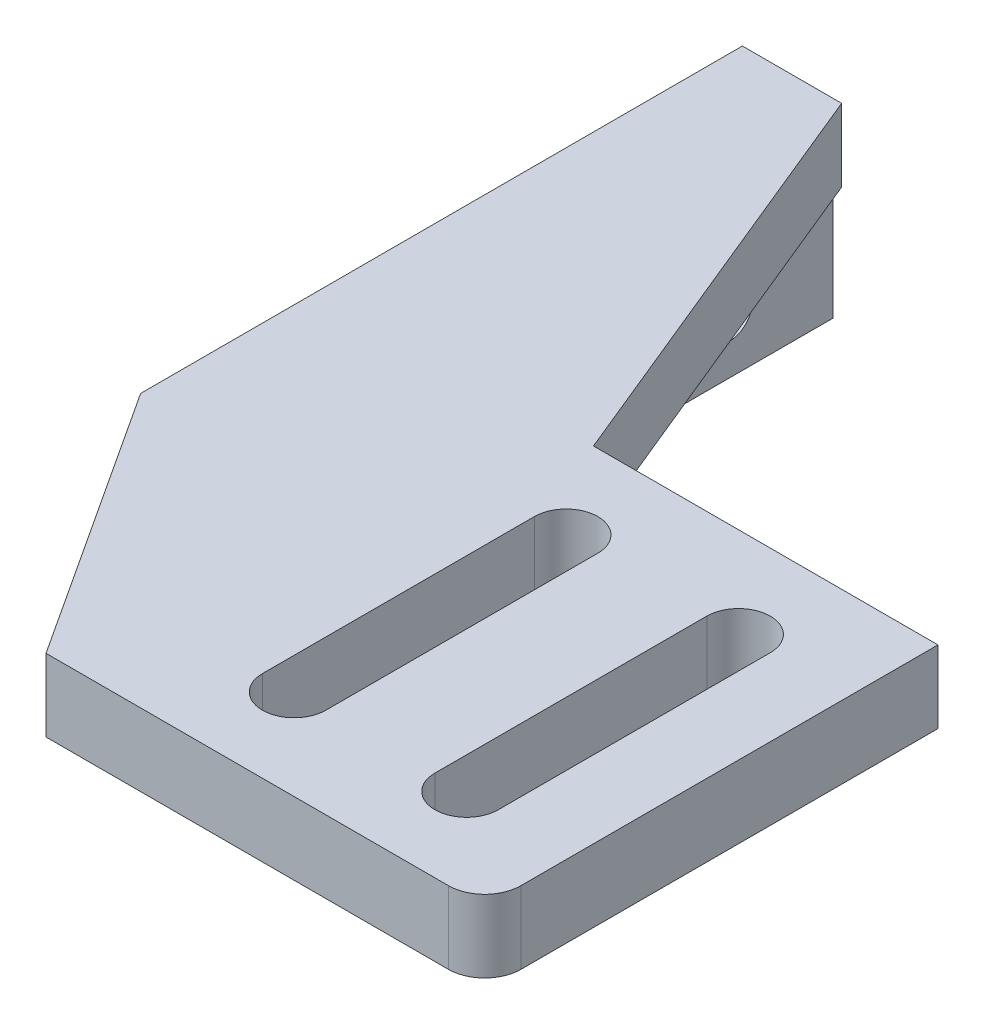
from build123d import *

# Parameters (mm, degrees)
ESTRUSIONE_ESTRUSIONE8_DEPTH = 4
SCHIZZO19_W                  = 5
SCHIZZO19_H                  = 48.212351189
ESTRUSIONE_ESTRUSIONE9_DEPTH = 6.5
SCHIZZO20_R                  = 1.25
TAGLIO_ESTRUSIONE9_DEPTH     = 6
TAGLIO_ESTRUSIONE13_DEPTH    = 21
SCHIZZO26_W                  = 5
SCHIZZO26_H                  = 6.5
TAGLIO_ESTRUSIONE15_DEPTH    = 21
RACCORDO1_R                  = 4
RACCORDO2_R                  = 2


with BuildPart() as part:
    # Schizzo18 → Estrusione-Estrusione8 (new body)
    with BuildSketch(Plane(origin=(0, 40, 0), x_dir=(1, 0, 0), z_dir=(0, 1, 0))):
        Polygon((25, -16), (-9, -16), (-9, 32.212351189), (-3.52472969, 32.212351189), (6, 9), (25, 9), align=None)
        with BuildLine():
            Line((17.25, -11), (17.25, 4))
            ThreePointArc((17.25, 4), (19, 5.75), (20.75, 4))
            Line((20.75, 4), (20.75, -11))
            ThreePointArc((20.75, -11), (19, -12.75), (17.25, -11))
        make_face(mode=Mode.SUBTRACT)
        with BuildLine():
            Line((7.74056589, -11), (7.74056589, 4))
            ThreePointArc((7.74056589, 4), (9.49056589, 5.75), (11.24056589, 4))
            Line((11.24056589, 4), (11.24056589, -11))
            ThreePointArc((11.24056589, -11), (9.49056589, -12.75), (7.74056589, -11))
        make_face(mode=Mode.SUBTRACT)
    extrude(amount=ESTRUSIONE_ESTRUSIONE8_DEPTH)

    # Schizzo19 → Estrusione-Estrusione9 (add)
    with BuildSketch(Plane.XZ.offset(-40)):
        with Locations((-6.5, -8.106175595)):
            Rectangle(SCHIZZO19_W, SCHIZZO19_H)
    extrude(amount=ESTRUSIONE_ESTRUSIONE9_DEPTH)

    # Schizzo20 → Taglio-Estrusione9 (cut)
    with BuildSketch(Plane.ZY.offset(9)):
        with Locations((-26.5, 36.5)):
            Circle(SCHIZZO20_R)
        with Locations((-16.5, 36.5)):
            Circle(SCHIZZO20_R)
    extrude(amount=-TAGLIO_ESTRUSIONE9_DEPTH, mode=Mode.SUBTRACT)

    # Schizzo24 → Taglio-Estrusione13 (cut)
    with BuildSketch(Plane(origin=(0, 44, 0), x_dir=(1, 0, 0), z_dir=(0, 1, 0))):
        Polygon((0.805132443, -16), (-9, -0.979024983), (-9, -16), align=None)
    extrude(amount=-TAGLIO_ESTRUSIONE13_DEPTH, mode=Mode.SUBTRACT)

    # Schizzo26 → Taglio-Estrusione15 (cut)
    with BuildSketch(Plane.XY.offset(0.979024983)):
        with Locations((-6.5, 36.75)):
            Rectangle(SCHIZZO26_W, SCHIZZO26_H)
    extrude(amount=TAGLIO_ESTRUSIONE15_DEPTH, mode=Mode.SUBTRACT)

    # Raccordo1
    raccordo1_edges = [part.edges().sort_by_distance(p)[0] for p in [
        (-6.5, 33.5, 0.979024983),
    ]]
    fillet(raccordo1_edges, radius=RACCORDO1_R)

    # Raccordo2
    raccordo2_edges = [part.edges().sort_by_distance(p)[0] for p in [
        (25, 42, 16),
    ]]
    fillet(raccordo2_edges, radius=RACCORDO2_R)


solid = part.part
